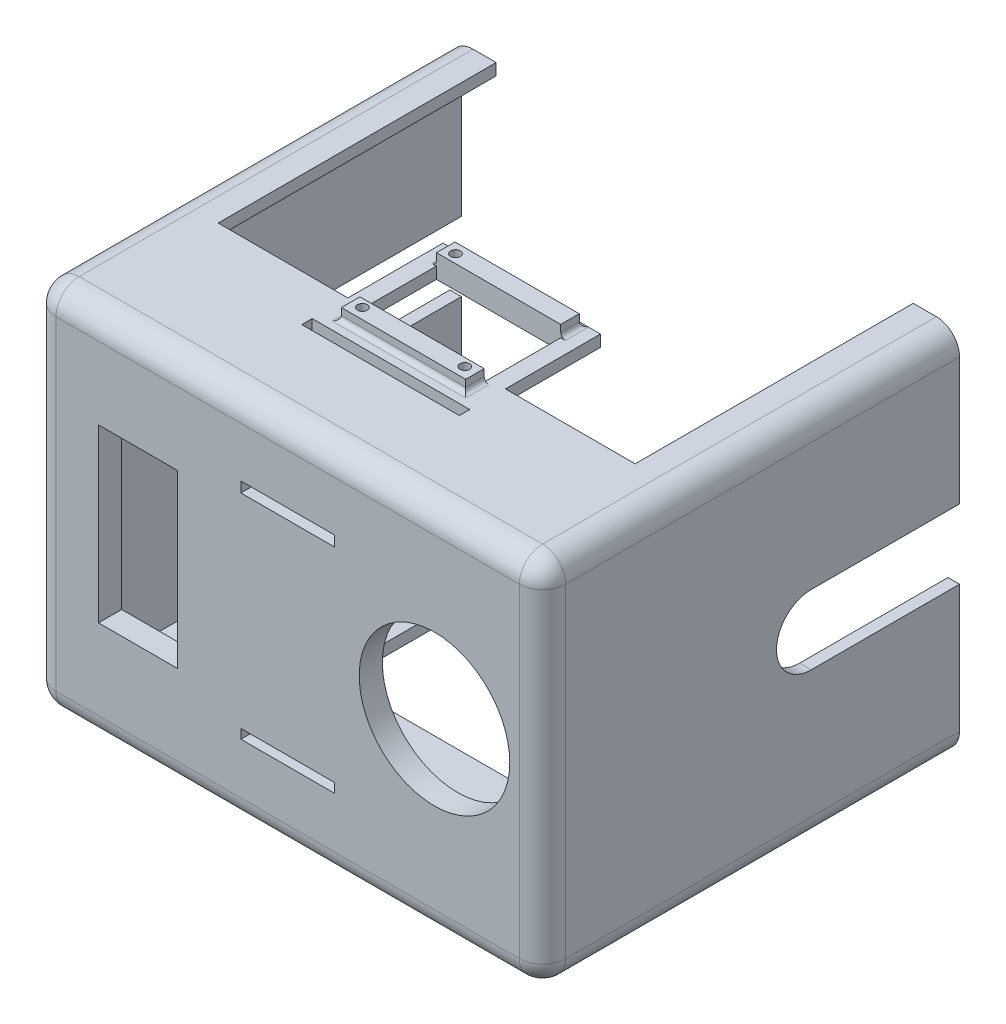
from build123d import *

# Parameters (mm, degrees)
ESQUISSE1_W             = 110
ESQUISSE1_H             = 100
BOSS_EXTRU_1_DEPTH      = 80
ESQUISSE3_W             = 105
ESQUISSE3_H             = 75
ENL_V_MAT_EXTRU_1_DEPTH = 95
ESQUISSE4_R             = 16.25
ESQUISSE4_W             = 17
ESQUISSE4_H             = 37
ESQUISSE4_W_2           = 20.218803133
ESQUISSE4_H_2           = 2.24
ESQUISSE4_W_3           = 20.22
ESQUISSE4_H_3           = 2.019806643
ENL_V_MAT_EXTRU_2_DEPTH = 143.051816821
CONG_2_R                = 5
ENL_V_MAT_EXTRU_3_DEPTH = 25
ENL_V_MAT_EXTRU_4_DEPTH = 147.026353909
ESQUISSE7_W             = 110
ESQUISSE7_H             = 10
ENL_V_MAT_EXTRU_5_DEPTH = 115.028131169
ESQUISSE8_R             = 1.05
BOSS_EXTRU_4_DEPTH      = 2.5
ESQUISSE12_W            = 26.823119757
ESQUISSE12_H            = 16.51929352
ENL_V_MAT_EXTRU_8_DEPTH = 2.5
CONG_3_R                = 1
ESQUISSE13_W            = 34
ESQUISSE13_H            = 2.25
ENL_V_MAT_EXTRU_9_DEPTH = 10


with BuildPart() as part:
    # Esquisse1 → Boss.-Extru.1 (new body)
    with BuildSketch(Plane(origin=(0, 0, 0), x_dir=(1, 0, 0), z_dir=(0, 1, 0))):
        with Locations((6.471283231, -3.138460985)):
            Rectangle(ESQUISSE1_W, ESQUISSE1_H)
    extrude(amount=BOSS_EXTRU_1_DEPTH)

    # Esquisse3 → Enlèv. mat.-Extru.1 (cut)
    with BuildSketch(Plane(origin=(0, 0, -46.861539015), x_dir=(-1, 0, 0), z_dir=(0, 0, -1))):
        with Locations((-6.471283231, 40)):
            Rectangle(ESQUISSE3_W, ESQUISSE3_H)
    extrude(amount=-ENL_V_MAT_EXTRU_1_DEPTH, mode=Mode.SUBTRACT)

    # Esquisse4 → Enlèv. mat.-Extru.2 (cut, through all)
    with BuildSketch(Plane.XY.offset(53.138460985)):
        with Locations((38.154925434, 40.636559031)):
            Circle(ESQUISSE4_R)
        with Locations((-25.851622586, 40.86253144)):
            Rectangle(ESQUISSE4_W, ESQUISSE4_H)
        with Locations((6.471283232, 63.12509684)):
            Rectangle(ESQUISSE4_W_2, ESQUISSE4_H_2)
        with Locations((6.470684798, 16.984999839)):
            Rectangle(ESQUISSE4_W_3, ESQUISSE4_H_3)
    extrude(amount=-ENL_V_MAT_EXTRU_2_DEPTH, mode=Mode.SUBTRACT)

    # Congé2
    cong_2_edges = [part.edges().sort_by_distance(p)[0] for p in [
        (61.471283231, 80, 3.138460985),
        (-48.528716769, 80, 3.138460985),
        (61.471283231, 0, 3.138460985),
        (6.471283231, 0, 53.138460985),
        (-48.528716769, 0, 3.138460985),
        (61.471283231, 40, 53.138460985),
        (-48.528716769, 40, 53.138460985),
        (6.471283231, 80, 53.138460985),
    ]]
    fillet(cong_2_edges, radius=CONG_2_R)

    # Esquisse5 → Enlèv. mat.-Extru.3 (cut)
    with BuildSketch(Plane.XZ):
        Polygon((6.471283231, -46.861539015), (32.471283231, -46.861539015), (32.471283231, 18.138460985), (-19.528716769, 18.138460985), (-19.528716769, -46.861539015), align=None)
    extrude(amount=-ENL_V_MAT_EXTRU_3_DEPTH, mode=Mode.SUBTRACT)

    # Esquisse6 → Enlèv. mat.-Extru.4 (cut, through all)
    with BuildSketch(Plane.ZY.offset(48.528716769)):
        with BuildLine():
            Line((-4.861539015, 47.5), (-46.861539015, 47.5))
            Line((-46.861539015, 47.5), (-46.861539015, 32.5))
            Line((-46.861539015, 32.5), (-4.861539015, 32.5))
            ThreePointArc((-4.861539015, 32.5), (2.638460985, 40), (-4.861539015, 47.5))
        make_face()
    extrude(amount=-ENL_V_MAT_EXTRU_4_DEPTH, mode=Mode.SUBTRACT)

    # Esquisse7 → Enlèv. mat.-Extru.5 (cut, through all)
    with BuildSketch(Plane.XZ):
        with Locations((6.471283231, -41.861539015)):
            Rectangle(ESQUISSE7_W, ESQUISSE7_H)
    extrude(amount=-ENL_V_MAT_EXTRU_5_DEPTH, mode=Mode.SUBTRACT)

    # Esquisse8 → Boss.-Extru.4 (add)
    # profile 1 of 2: a face of its own
    with BuildSketch(Plane(origin=(0, 80, 0), x_dir=(1, 0, 0), z_dir=(0, 1, 0))):
        Polygon((-6.940276647, -28.138460985), (19.88284311, -28.138460985), (19.88284311, -24.138460985), (2.406600831, -24.138460985), (-6.940276647, -24.138460985), align=None)
        with Locations(Location((17.406091919, -25.845902422, 0), (0, 0, 270))):
            Circle(ESQUISSE8_R, mode=Mode.SUBTRACT)
        with Locations(Location((-4.693908081, -25.845902422, 0), (0, 0, 270))):
            Circle(ESQUISSE8_R, mode=Mode.SUBTRACT)
    # profile 2 of 2: a face of its own
    with BuildSketch(Plane(origin=(0, 80, 0), x_dir=(1, 0, 0), z_dir=(0, 1, 0))):
        Polygon((-6.940276647, -3.619167465), (19.88284311, -3.619167465), (19.88284311, -7.619167465), (2.406600831, -7.619167465), (-6.940276647, -7.619167465), align=None)
        with Locations(Location((-4.693908081, -5.745902422, 0), (0, 0, 270))):
            Circle(ESQUISSE8_R, mode=Mode.SUBTRACT)
    extrude(amount=BOSS_EXTRU_4_DEPTH)

    # Esquisse12 → Enlèv. mat.-Extru.8 (cut)
    with BuildSketch(Plane(origin=(0, 80, 0), x_dir=(1, 0, 0), z_dir=(0, 1, 0))):
        with Locations((6.471283231, -15.878814225)):
            Rectangle(ESQUISSE12_W, ESQUISSE12_H)
    extrude(amount=-ENL_V_MAT_EXTRU_8_DEPTH, mode=Mode.SUBTRACT)

    # Congé3
    # the kernel refuses this fillet: 1 mm, written as the material it adds along each edge
    with BuildSketch(Plane(origin=(19.88284311, 80, 3.619167465), x_dir=(1, 0, 0), z_dir=(0, 0, 1))) as cong_3_piece_1_section:
        with BuildLine():
            CenterArc((CONG_3_R, CONG_3_R), CONG_3_R, 180, 90)
            Line((0, CONG_3_R), (-CONG_3_R * 0.02, CONG_3_R))
            Line((-CONG_3_R * 0.02, CONG_3_R), (-CONG_3_R * 0.02, -CONG_3_R * 0.02))
            Line((-CONG_3_R * 0.02, -CONG_3_R * 0.02), (CONG_3_R, -CONG_3_R * 0.02))
            Line((CONG_3_R, -CONG_3_R * 0.02), (CONG_3_R, 0))
        make_face()
    cong_3_piece_1 = extrude(amount=4, mode=Mode.PRIVATE)
    cong_3_piece_1 = split(cong_3_piece_1, bisect_by=Plane(origin=(19.88284311, 80.20347313, 5.619167465), z_dir=(1, 0, 0)), keep=Keep.TOP, mode=Mode.PRIVATE)
    add(cong_3_piece_1)
    with BuildSketch(Plane(origin=(-6.940276647, 80, 3.619167465), x_dir=(0, 0, -1), z_dir=(1, 0, 0))) as cong_3_piece_2:
        with BuildLine():
            CenterArc((CONG_3_R, CONG_3_R), CONG_3_R, 180, 90)
            Line((0, CONG_3_R), (-CONG_3_R * 0.02, CONG_3_R))
            Line((-CONG_3_R * 0.02, CONG_3_R), (-CONG_3_R * 0.02, -CONG_3_R * 0.02))
            Line((-CONG_3_R * 0.02, -CONG_3_R * 0.02), (CONG_3_R, -CONG_3_R * 0.02))
            Line((CONG_3_R, -CONG_3_R * 0.02), (CONG_3_R, 0))
        make_face()
    extrude(amount=26.823119757)
    with BuildSketch(Plane(origin=(-6.940276647, 80, 7.619167465), x_dir=(-1, 0, 0), z_dir=(0, 0, -1))) as cong_3_piece_3_section:
        with BuildLine():
            CenterArc((CONG_3_R, CONG_3_R), CONG_3_R, 180, 90)
            Line((0, CONG_3_R), (-CONG_3_R * 0.02, CONG_3_R))
            Line((-CONG_3_R * 0.02, CONG_3_R), (-CONG_3_R * 0.02, -CONG_3_R * 0.02))
            Line((-CONG_3_R * 0.02, -CONG_3_R * 0.02), (CONG_3_R, -CONG_3_R * 0.02))
            Line((CONG_3_R, -CONG_3_R * 0.02), (CONG_3_R, 0))
        make_face()
    cong_3_piece_3 = extrude(amount=4, mode=Mode.PRIVATE)
    cong_3_piece_3 = split(cong_3_piece_3, bisect_by=Plane(origin=(-6.940276647, 80.20347313, 5.619167465), z_dir=(-1, 0, 0)), keep=Keep.TOP, mode=Mode.PRIVATE)
    add(cong_3_piece_3)
    with BuildSketch(Plane(origin=(-6.940276647, 80, 24.138460985), x_dir=(-1, 0, 0), z_dir=(0, 0, 1))) as cong_3_piece_4_section:
        with BuildLine():
            CenterArc((CONG_3_R, -CONG_3_R), CONG_3_R, 90, 90)
            Line((0, -CONG_3_R), (-CONG_3_R * 0.02, -CONG_3_R))
            Line((-CONG_3_R * 0.02, -CONG_3_R), (-CONG_3_R * 0.02, CONG_3_R * 0.02))
            Line((-CONG_3_R * 0.02, CONG_3_R * 0.02), (CONG_3_R, CONG_3_R * 0.02))
            Line((CONG_3_R, CONG_3_R * 0.02), (CONG_3_R, 0))
        make_face()
    cong_3_piece_4 = extrude(amount=4, mode=Mode.PRIVATE)
    cong_3_piece_4 = split(cong_3_piece_4, bisect_by=Plane(origin=(-6.940276647, 80.20347313, 26.138460985), z_dir=(-1, 0, 0)), keep=Keep.TOP, mode=Mode.PRIVATE)
    add(cong_3_piece_4)
    with BuildSketch(Plane(origin=(-6.940276647, 80, 28.138460985), x_dir=(0, 0, 1), z_dir=(1, 0, 0))) as cong_3_piece_5:
        with BuildLine():
            CenterArc((CONG_3_R, -CONG_3_R), CONG_3_R, 90, 90)
            Line((0, -CONG_3_R), (-CONG_3_R * 0.02, -CONG_3_R))
            Line((-CONG_3_R * 0.02, -CONG_3_R), (-CONG_3_R * 0.02, CONG_3_R * 0.02))
            Line((-CONG_3_R * 0.02, CONG_3_R * 0.02), (CONG_3_R, CONG_3_R * 0.02))
            Line((CONG_3_R, CONG_3_R * 0.02), (CONG_3_R, 0))
        make_face()
    extrude(amount=26.823119757)
    with BuildSketch(Plane(origin=(19.88284311, 80, 28.138460985), x_dir=(1, 0, 0), z_dir=(0, 0, -1))) as cong_3_piece_6_section:
        with BuildLine():
            CenterArc((CONG_3_R, -CONG_3_R), CONG_3_R, 90, 90)
            Line((0, -CONG_3_R), (-CONG_3_R * 0.02, -CONG_3_R))
            Line((-CONG_3_R * 0.02, -CONG_3_R), (-CONG_3_R * 0.02, CONG_3_R * 0.02))
            Line((-CONG_3_R * 0.02, CONG_3_R * 0.02), (CONG_3_R, CONG_3_R * 0.02))
            Line((CONG_3_R, CONG_3_R * 0.02), (CONG_3_R, 0))
        make_face()
    cong_3_piece_6 = extrude(amount=4, mode=Mode.PRIVATE)
    cong_3_piece_6 = split(cong_3_piece_6, bisect_by=Plane(origin=(19.88284311, 80.20347313, 26.138460985), z_dir=(1, 0, 0)), keep=Keep.TOP, mode=Mode.PRIVATE)
    add(cong_3_piece_6)
    with BuildSketch(Plane(origin=(-6.940276647, 80, 3.619167465), x_dir=(0, 0, -1), z_dir=(1, 0, 0))) as cong_3_piece_7a_section:
        with BuildLine():
            CenterArc((CONG_3_R, CONG_3_R), CONG_3_R, 180, 90)
            Line((0, CONG_3_R), (-CONG_3_R * 0.02, CONG_3_R))
            Line((-CONG_3_R * 0.02, CONG_3_R), (-CONG_3_R * 0.02, -CONG_3_R * 0.02))
            Line((-CONG_3_R * 0.02, -CONG_3_R * 0.02), (CONG_3_R, -CONG_3_R * 0.02))
            Line((CONG_3_R, -CONG_3_R * 0.02), (CONG_3_R, 0))
        make_face()
    cong_3_piece_7a = extrude(amount=29.323119757, mode=Mode.PRIVATE)
    cong_3_piece_7a = split(cong_3_piece_7a, bisect_by=Plane(origin=(19.88284311, 80.226395114, 3.39277235), z_dir=(1, 0, 0)), keep=Keep.TOP, mode=Mode.PRIVATE)
    with BuildSketch(Plane(origin=(19.88284311, 80, 1.119167465), x_dir=(1, 0, 0), z_dir=(0, 0, 1))) as cong_3_piece_7b_section:
        with BuildLine():
            CenterArc((CONG_3_R, CONG_3_R), CONG_3_R, 180, 90)
            Line((0, CONG_3_R), (-CONG_3_R * 0.02, CONG_3_R))
            Line((-CONG_3_R * 0.02, CONG_3_R), (-CONG_3_R * 0.02, -CONG_3_R * 0.02))
            Line((-CONG_3_R * 0.02, -CONG_3_R * 0.02), (CONG_3_R, -CONG_3_R * 0.02))
            Line((CONG_3_R, -CONG_3_R * 0.02), (CONG_3_R, 0))
        make_face()
    cong_3_piece_7b = extrude(amount=6.5, mode=Mode.PRIVATE)
    cong_3_piece_7b = split(cong_3_piece_7b, bisect_by=Plane(origin=(19.88284311, 80.20347313, 2.369167465), z_dir=(1, 0, 0)), keep=Keep.TOP, mode=Mode.PRIVATE)
    cong_3_piece_7b = split(cong_3_piece_7b, bisect_by=Plane(origin=(20.12979416, 80.20347313, 3.619167465), z_dir=(0, 0, -1)), keep=Keep.TOP, mode=Mode.PRIVATE)
    cong_3_piece_7 = cong_3_piece_7a & cong_3_piece_7b
    add(cong_3_piece_7)
    with BuildSketch(Plane(origin=(-6.940276647, 80, 7.619167465), x_dir=(-1, 0, 0), z_dir=(0, 0, -1))) as cong_3_piece_8a_section:
        with BuildLine():
            CenterArc((CONG_3_R, CONG_3_R), CONG_3_R, 180, 90)
            Line((0, CONG_3_R), (-CONG_3_R * 0.02, CONG_3_R))
            Line((-CONG_3_R * 0.02, CONG_3_R), (-CONG_3_R * 0.02, -CONG_3_R * 0.02))
            Line((-CONG_3_R * 0.02, -CONG_3_R * 0.02), (CONG_3_R, -CONG_3_R * 0.02))
            Line((CONG_3_R, -CONG_3_R * 0.02), (CONG_3_R, 0))
        make_face()
    cong_3_piece_8a = extrude(amount=6.5, mode=Mode.PRIVATE)
    cong_3_piece_8a = split(cong_3_piece_8a, bisect_by=Plane(origin=(-6.940276647, 80.20347313, 2.369167465), z_dir=(-1, 0, 0)), keep=Keep.TOP, mode=Mode.PRIVATE)
    cong_3_piece_8a = split(cong_3_piece_8a, bisect_by=Plane(origin=(-7.187227698, 80.20347313, 3.619167465), z_dir=(0, 0, -1)), keep=Keep.TOP, mode=Mode.PRIVATE)
    with BuildSketch(Plane(origin=(-9.440276647, 80, 3.619167465), x_dir=(0, 0, -1), z_dir=(1, 0, 0))) as cong_3_piece_8b_section:
        with BuildLine():
            CenterArc((CONG_3_R, CONG_3_R), CONG_3_R, 180, 90)
            Line((0, CONG_3_R), (-CONG_3_R * 0.02, CONG_3_R))
            Line((-CONG_3_R * 0.02, CONG_3_R), (-CONG_3_R * 0.02, -CONG_3_R * 0.02))
            Line((-CONG_3_R * 0.02, -CONG_3_R * 0.02), (CONG_3_R, -CONG_3_R * 0.02))
            Line((CONG_3_R, -CONG_3_R * 0.02), (CONG_3_R, 0))
        make_face()
    cong_3_piece_8b = extrude(amount=29.323119757, mode=Mode.PRIVATE)
    cong_3_piece_8b = split(cong_3_piece_8b, bisect_by=Plane(origin=(-6.940276647, 80.226395114, 3.39277235), z_dir=(-1, 0, 0)), keep=Keep.TOP, mode=Mode.PRIVATE)
    cong_3_piece_8 = cong_3_piece_8a & cong_3_piece_8b
    add(cong_3_piece_8)
    with BuildSketch(Plane(origin=(-9.440276647, 80, 28.138460985), x_dir=(0, 0, 1), z_dir=(1, 0, 0))) as cong_3_piece_9a_section:
        with BuildLine():
            CenterArc((CONG_3_R, -CONG_3_R), CONG_3_R, 90, 90)
            Line((0, -CONG_3_R), (-CONG_3_R * 0.02, -CONG_3_R))
            Line((-CONG_3_R * 0.02, -CONG_3_R), (-CONG_3_R * 0.02, CONG_3_R * 0.02))
            Line((-CONG_3_R * 0.02, CONG_3_R * 0.02), (CONG_3_R, CONG_3_R * 0.02))
            Line((CONG_3_R, CONG_3_R * 0.02), (CONG_3_R, 0))
        make_face()
    cong_3_piece_9a = extrude(amount=29.323119757, mode=Mode.PRIVATE)
    cong_3_piece_9a = split(cong_3_piece_9a, bisect_by=Plane(origin=(-6.940276647, 80.226395114, 28.3648561), z_dir=(-1, 0, 0)), keep=Keep.TOP, mode=Mode.PRIVATE)
    with BuildSketch(Plane(origin=(-6.940276647, 80, 24.138460985), x_dir=(-1, 0, 0), z_dir=(0, 0, 1))) as cong_3_piece_9b_section:
        with BuildLine():
            CenterArc((CONG_3_R, -CONG_3_R), CONG_3_R, 90, 90)
            Line((0, -CONG_3_R), (-CONG_3_R * 0.02, -CONG_3_R))
            Line((-CONG_3_R * 0.02, -CONG_3_R), (-CONG_3_R * 0.02, CONG_3_R * 0.02))
            Line((-CONG_3_R * 0.02, CONG_3_R * 0.02), (CONG_3_R, CONG_3_R * 0.02))
            Line((CONG_3_R, CONG_3_R * 0.02), (CONG_3_R, 0))
        make_face()
    cong_3_piece_9b = extrude(amount=6.5, mode=Mode.PRIVATE)
    cong_3_piece_9b = split(cong_3_piece_9b, bisect_by=Plane(origin=(-6.940276647, 80.20347313, 29.388460985), z_dir=(-1, 0, 0)), keep=Keep.TOP, mode=Mode.PRIVATE)
    cong_3_piece_9b = split(cong_3_piece_9b, bisect_by=Plane(origin=(-7.187227698, 80.20347313, 28.138460985), z_dir=(0, 0, 1)), keep=Keep.TOP, mode=Mode.PRIVATE)
    cong_3_piece_9 = cong_3_piece_9a & cong_3_piece_9b
    add(cong_3_piece_9)
    with BuildSketch(Plane(origin=(19.88284311, 80, 30.638460985), x_dir=(1, 0, 0), z_dir=(0, 0, -1))) as cong_3_piece_10a_section:
        with BuildLine():
            CenterArc((CONG_3_R, -CONG_3_R), CONG_3_R, 90, 90)
            Line((0, -CONG_3_R), (-CONG_3_R * 0.02, -CONG_3_R))
            Line((-CONG_3_R * 0.02, -CONG_3_R), (-CONG_3_R * 0.02, CONG_3_R * 0.02))
            Line((-CONG_3_R * 0.02, CONG_3_R * 0.02), (CONG_3_R, CONG_3_R * 0.02))
            Line((CONG_3_R, CONG_3_R * 0.02), (CONG_3_R, 0))
        make_face()
    cong_3_piece_10a = extrude(amount=6.5, mode=Mode.PRIVATE)
    cong_3_piece_10a = split(cong_3_piece_10a, bisect_by=Plane(origin=(19.88284311, 80.20347313, 29.388460985), z_dir=(1, 0, 0)), keep=Keep.TOP, mode=Mode.PRIVATE)
    cong_3_piece_10a = split(cong_3_piece_10a, bisect_by=Plane(origin=(20.12979416, 80.20347313, 28.138460985), z_dir=(0, 0, 1)), keep=Keep.TOP, mode=Mode.PRIVATE)
    with BuildSketch(Plane(origin=(-6.940276647, 80, 28.138460985), x_dir=(0, 0, 1), z_dir=(1, 0, 0))) as cong_3_piece_10b_section:
        with BuildLine():
            CenterArc((CONG_3_R, -CONG_3_R), CONG_3_R, 90, 90)
            Line((0, -CONG_3_R), (-CONG_3_R * 0.02, -CONG_3_R))
            Line((-CONG_3_R * 0.02, -CONG_3_R), (-CONG_3_R * 0.02, CONG_3_R * 0.02))
            Line((-CONG_3_R * 0.02, CONG_3_R * 0.02), (CONG_3_R, CONG_3_R * 0.02))
            Line((CONG_3_R, CONG_3_R * 0.02), (CONG_3_R, 0))
        make_face()
    cong_3_piece_10b = extrude(amount=29.323119757, mode=Mode.PRIVATE)
    cong_3_piece_10b = split(cong_3_piece_10b, bisect_by=Plane(origin=(19.88284311, 80.226395114, 28.3648561), z_dir=(1, 0, 0)), keep=Keep.TOP, mode=Mode.PRIVATE)
    cong_3_piece_10 = cong_3_piece_10a & cong_3_piece_10b
    add(cong_3_piece_10)

    # Esquisse13 → Enlèv. mat.-Extru.9 (cut)
    with BuildSketch(Plane(origin=(0, 80, 0), x_dir=(1, 0, 0), z_dir=(0, 1, 0))):
        Polygon((-38.528716769, 36.861539015), (51.471283231, 36.861539015), (51.471283231, -23.138460985), (23.471283231, -23.138460985), (23.471283231, -2.619167465), (-10.528716769, -2.619167465), (-10.528716769, -23.138460985), (-38.528716769, -23.138460985), align=None)
        with Locations((6.471283231, -31.970902422)):
            Rectangle(ESQUISSE13_W, ESQUISSE13_H)
    extrude(amount=-ENL_V_MAT_EXTRU_9_DEPTH, mode=Mode.SUBTRACT)


solid = part.part
